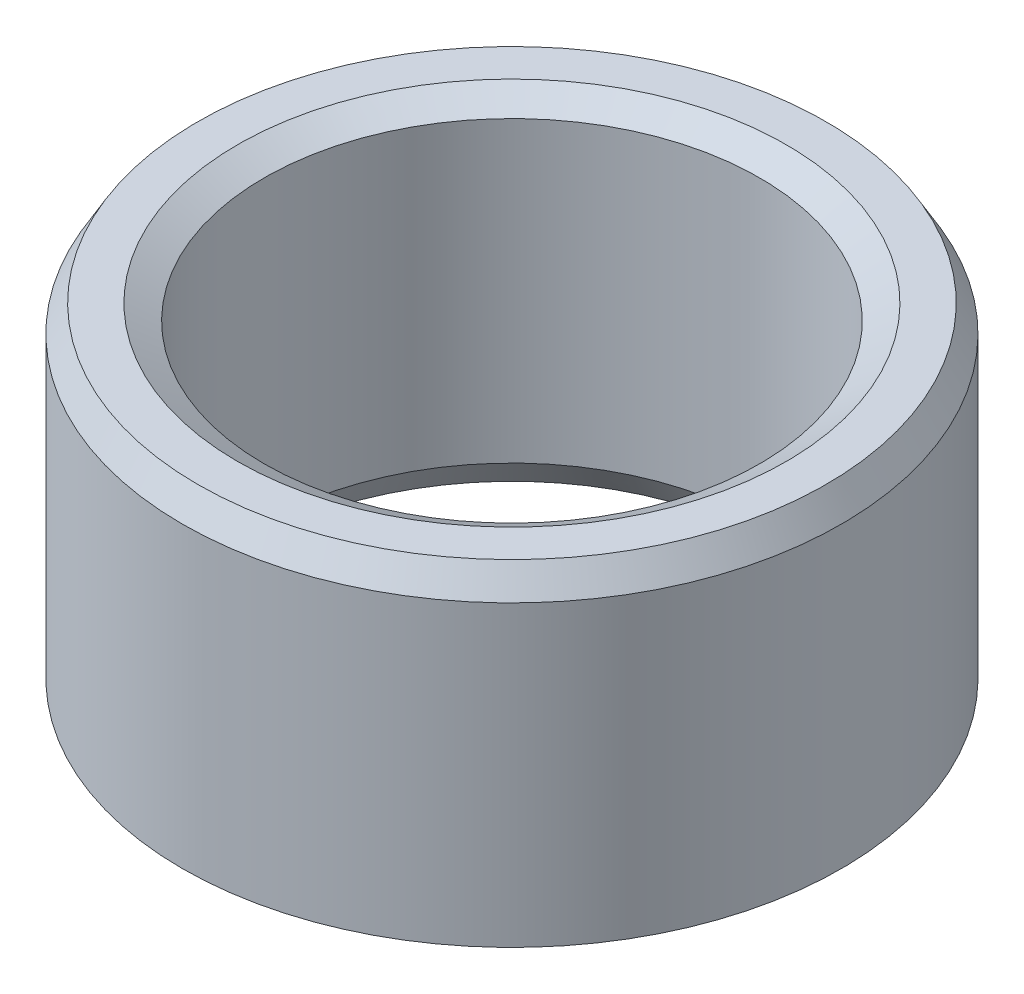
from build123d import *
from OCP.BRepFilletAPI import BRepFilletAPI_MakeChamfer

# Parameters (mm, degrees)
SKETCH1_R           = 30
BOSS_EXTRUDE1_DEPTH = 30.984801973
SKETCH2_R           = 22.551552848
CUT_EXTRUDE1_DEPTH  = 53.536253704
CHAMFER1_SIZE       = 2.42528849
CHAMFER1_SIZE2      = 1.400240963


with BuildPart() as part:
    # Sketch1 → Boss-Extrude1 (new body)
    with BuildSketch(Plane(origin=(0, 0, 0), x_dir=(1, 0, 0), z_dir=(0, 1, 0))):
        Circle(SKETCH1_R)
    extrude(amount=BOSS_EXTRUDE1_DEPTH)

    # Sketch2 → Cut-Extrude1 (cut, through all)
    with BuildSketch(Plane(origin=(0, 0, 0), x_dir=(1, 0, 0), z_dir=(0, 1, 0))):
        Circle(SKETCH2_R)
    extrude(amount=CUT_EXTRUDE1_DEPTH, mode=Mode.SUBTRACT)

    # Chamfer1: one chamfer whose edges measure the first distance from different faces: ONE call of the kernel's chamfer builder (chamfer() names one face for all edges)
    chamfer1_edges_1 = [part.edges().sort_by_distance(p)[0] for p in [
        (-22.551552848, 30.984801973, 0),
    ]]
    chamfer1_side_1 = [part.faces().sort_by_distance(p)[0] for p in [
        (-29.151471863, 30.984801973, 0),
    ]]
    chamfer1_edges_2 = [part.edges().sort_by_distance(p)[0] for p in [
        (-22.551552848, 0, 0),
    ]]
    chamfer1_side_2 = [part.faces().sort_by_distance(p)[0] for p in [
        (-22.551552848, 15.492400986, 0),
    ]]
    chamfer1_edges_3 = [part.edges().sort_by_distance(p)[0] for p in [
        (-30, 0, 0),
    ]]
    chamfer1_side_3 = [part.faces().sort_by_distance(p)[0] for p in [
        (-29.151471863, 0, 0),
    ]]
    chamfer1_edges_4 = [part.edges().sort_by_distance(p)[0] for p in [
        (-30, 30.984801973, 0),
    ]]
    chamfer1_side_4 = [part.faces().sort_by_distance(p)[0] for p in [
        (-30, 15.492400986, 0),
    ]]
    chamfer1 = BRepFilletAPI_MakeChamfer(part.part.solid().wrapped)
    for e in chamfer1_edges_1:
        chamfer1.Add(CHAMFER1_SIZE, CHAMFER1_SIZE2, e.wrapped, chamfer1_side_1[0].wrapped)  # the first distance lies on this face
    for e in chamfer1_edges_2:
        chamfer1.Add(CHAMFER1_SIZE, CHAMFER1_SIZE2, e.wrapped, chamfer1_side_2[0].wrapped)  # the first distance lies on this face
    for e in chamfer1_edges_3:
        chamfer1.Add(CHAMFER1_SIZE, CHAMFER1_SIZE2, e.wrapped, chamfer1_side_3[0].wrapped)  # the first distance lies on this face
    for e in chamfer1_edges_4:
        chamfer1.Add(CHAMFER1_SIZE, CHAMFER1_SIZE2, e.wrapped, chamfer1_side_4[0].wrapped)  # the first distance lies on this face
    add(Compound.cast(chamfer1.Shape()), mode=Mode.REPLACE)


solid = part.part
